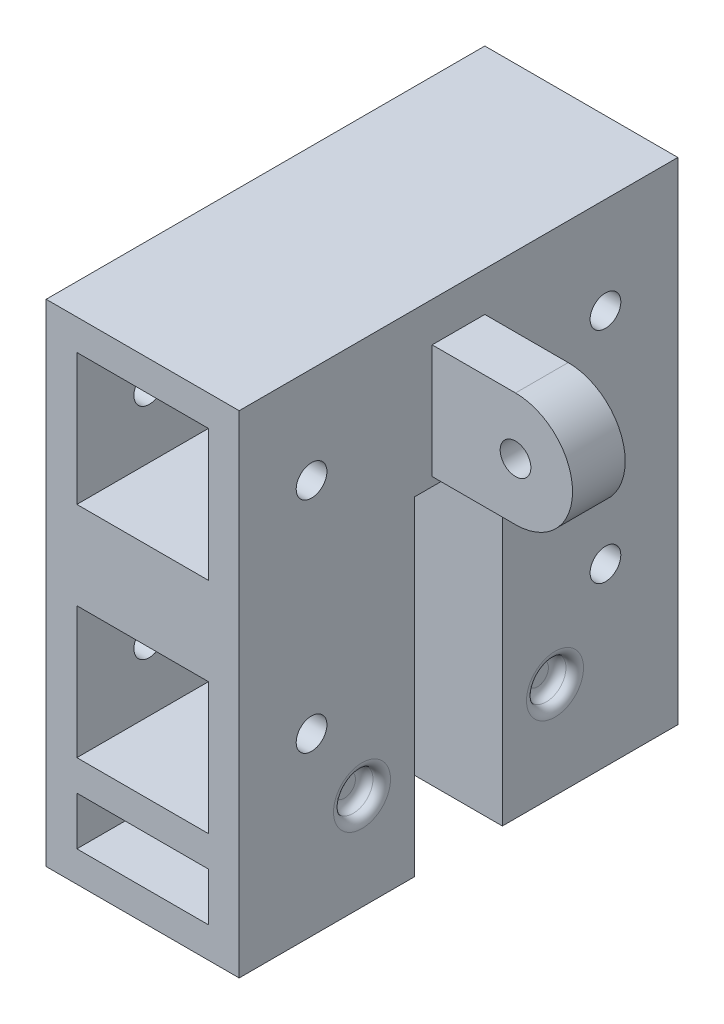
from build123d import *

# Parameters (mm, degrees)
SKETCH1_W                = 22
SKETCH1_H                = 56
SKETCH1_W_2              = 15
SKETCH1_H_2              = 15
BOSS_EXTRUDE1_DEPTH      = 20
SKETCH2_W                = 15
SKETCH2_H                = 15
SKETCH2_H_2              = 5.5
CUT_EXTRUDE1_DEPTH       = 15.5
SKETCH3_R                = 1.75
CUT_EXTRUDE2_DEPTH       = 35
BOSS_EXTRUDE2_DEPTH      = 10
BOSS_EXTRUDE3_DEPTH      = 3
BOSS_EXTRUDE3_DEPTH_BACK = 3
SKETCH6_R                = 1.75
SKETCH7_R                = 2.25
CUT_EXTRUDE3_DEPTH       = 2
FILLET1_R                = 1


with BuildPart() as part:
    # Sketch1 → Boss-Extrude1 (new body)
    with BuildSketch(Plane.XY):
        with Locations((-14.096172604, 14.333947726)):
            Rectangle(SKETCH1_W, SKETCH1_H)
        with Locations((-14.096172604, 31.333947726)):
            Rectangle(SKETCH1_W_2, SKETCH1_H_2, mode=Mode.SUBTRACT)
    extrude(amount=BOSS_EXTRUDE1_DEPTH)

    # Sketch2 → Cut-Extrude1 (cut)
    with BuildSketch(Plane.XY.offset(20)):
        with Locations((-14.096172604, 6.333947726)):
            Rectangle(SKETCH2_W, SKETCH2_H)
        with Locations((-14.096172604, -7.416052274)):
            Rectangle(SKETCH2_W, SKETCH2_H_2)
    extrude(amount=-CUT_EXTRUDE1_DEPTH, mode=Mode.SUBTRACT)

    # Sketch3 → Cut-Extrude2 (cut)
    with BuildSketch(Plane.ZY.offset(25.096172604)):
        with Locations(Location((11.75, 31.333947726, 0), (0, 0, 270))):
            Circle(SKETCH3_R)
        with Locations(Location((11.75, 6.333947726, 0), (0, 0, 90))):
            Circle(SKETCH3_R)
    extrude(amount=-CUT_EXTRUDE2_DEPTH, mode=Mode.SUBTRACT)


with BuildPart() as body_2:
    # Mirror3: mirrored copy
    add(part.part.mirror(Plane(origin=(0, 0, -5), x_dir=(1, 0, 0), z_dir=(0, 0, -1))))


with BuildPart() as part_1:
    add(part.part)

    add(body_2.part)  # Boss-Extrude2 merges body 2
    # Sketch4 → Boss-Extrude2 (add)
    with BuildSketch(Plane(origin=(0, 0, 0), x_dir=(-1, 0, 0), z_dir=(0, 0, -1))):
        Polygon((6.596172604, 38.833947726), (21.596172604, 38.833947726), (21.596172604, 23.833947726), (25.096172604, 23.833947726), (25.096172604, 42.333947726), (3.096172604, 42.333947726), (3.096172604, 23.833947726), (6.596172604, 23.833947726), align=None)
    extrude(amount=BOSS_EXTRUDE2_DEPTH)

    # Sketch6 → Boss-Extrude3 (add, two sides: drawn at the far end of the back side and taken through both)
    with BuildSketch(Plane(origin=(0, 0, -5), x_dir=(-1, 0, 0), z_dir=(0, 0, -1)).offset(-BOSS_EXTRUDE3_DEPTH_BACK)):
        with BuildLine():
            Line((-6.403827396, 37.833947726), (3.096172604, 37.833947726))
            Line((3.096172604, 37.833947726), (3.096172604, 24.833947726))
            Line((3.096172604, 24.833947726), (-6.403827396, 24.833947726))
            ThreePointArc((-6.403827396, 24.833947726), (-12.903827396, 31.333947726), (-6.403827396, 37.833947726))
        make_face()
        with Locations((-6.403827396, 31.333947726)):
            Circle(SKETCH6_R, mode=Mode.SUBTRACT)
    extrude(amount=BOSS_EXTRUDE3_DEPTH + BOSS_EXTRUDE3_DEPTH_BACK)

    # Sketch7 → Cut-Extrude3 (cut)
    with BuildSketch(Plane(origin=(-3.096172604, 0, 0), x_dir=(0, 0, -1), z_dir=(1, 0, 0))):
        with Locations(Location((16, -2.666052274, 0), (0, 0, 90))):
            Circle(SKETCH7_R)
        with Locations(Location((-6, -2.666052274, 0), (0, 0, 90))):
            Circle(SKETCH7_R)
    extrude(amount=-CUT_EXTRUDE3_DEPTH, mode=Mode.SUBTRACT)

    # Fillet1
    fillet1_edges = [part_1.edges().sort_by_distance(p)[0] for p in [
        (-5.096172604, -4.916052274, -16),
        (-3.096172604, -4.916052274, -16),
        (-5.096172604, -4.916052274, 6),
        (-3.096172604, -4.916052274, 6),
    ]]
    fillet(fillet1_edges, radius=FILLET1_R - 0.0001)  # a hair under: the kernel refuses the full size


solid = part_1.part
